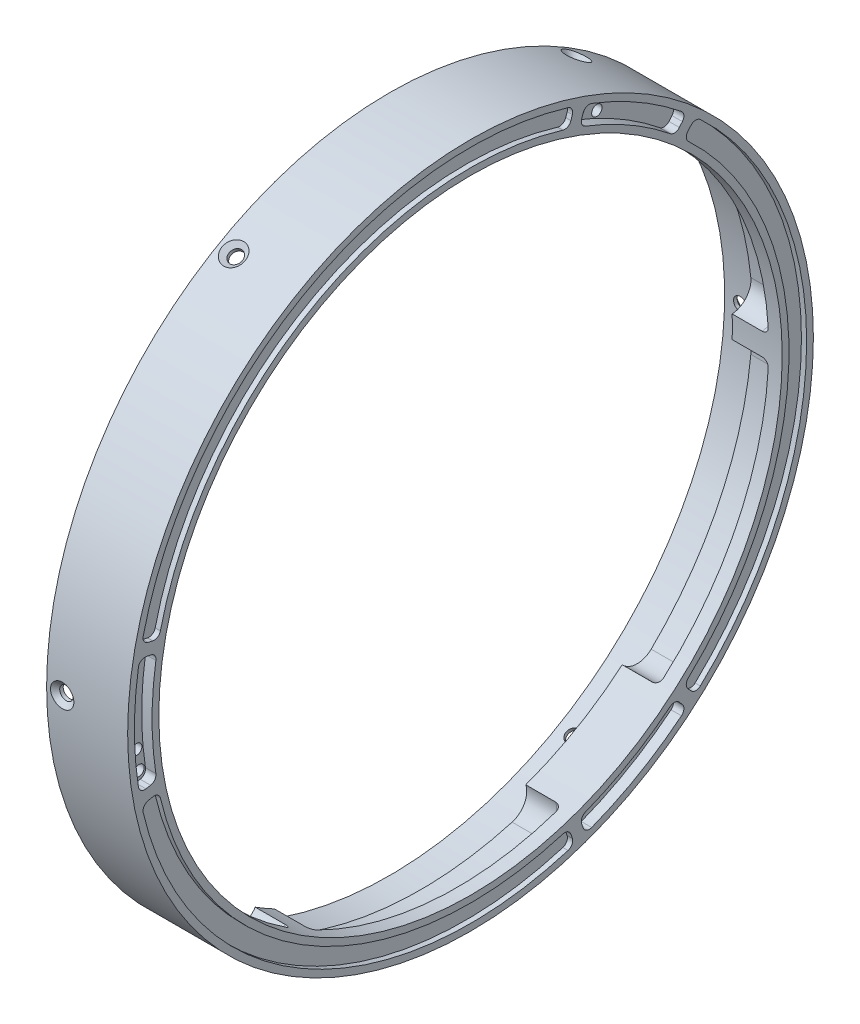
from build123d import *

# Parameters (mm, degrees)
CUT_EXTRUDE3_DEPTH       = 8.89
CIRPATTERN4_COUNT        = 6
FILLET1_R                = 1.5875
CIRPATTERN3_COUNT        = 3
FILLET1_OF_CIRPATTERN3_R = 1.5875
CUT_EXTRUDE4_DEPTH       = 2.54
FILLET2_R                = 1.5875
CIRPATTERN5_COUNT        = 3
FILLET2_OF_CIRPATTERN5_R = 1.5875
CUT_EXTRUDE5_DEPTH       = 1.27
SKETCH17_R               = 1.27
CUT_EXTRUDE6_DEPTH       = 182.467668846
FILLET3_R                = 1.5875
CIRPATTERN6_COUNT        = 3
FILLET3_OF_CIRPATTERN6_R = 1.5875


# Read off the part's stored shape, not the designer's step: CSK for #4 Flat Head Machine Screw (100)1
with BuildPart() as part:
    # Sketch1 → Revolve1 (revolve)
    with BuildSketch(Plane(origin=(0, 0, 0), x_dir=(1, 0, 0), z_dir=(0, 1, 0)), mode=Mode.PRIVATE) as revolve1_sk:
        Polygon((12.192, 0.508), (12.192, 0), (0, 0), (0, 5.7404), (-7.62, 5.7404), (-7.62, 7.62), (0.762, 7.62), (12.192, 7.62), align=None)
    revolve(revolve1_sk.sketch.rotate(Axis((-6.35, 0, 76.2), (1, 0, 0)), 180), axis=Axis((-6.35, 0, 76.2), (1, 0, 0)))

    # CSK for _4 Flat Head Machine Screw _ 2 → CSK for #4 Flat Head Machine Screw (100)1 (revolve, cut)
    with BuildSketch(Plane(origin=(-3.81, 0, 0), x_dir=(1, 0, 0), z_dir=(0, -1, 0))):
        Polygon((1.63195, -6.591641447), (1.63195, -5.724138447), (0, -5.724138447), (0, -7.620016713), (2.857519918, -7.620016713), align=None)
    csk_for_4_flat_head_machine_screw_100 = revolve(axis=Axis((-3.81, 0, 0), (0, 0, 1)), mode=Mode.SUBTRACT)

    # Sketch10 → Cut-Extrude3 (cut)
    with BuildSketch(Plane.ZY):
        with BuildLine():
            ThreePointArc((0.048494434, -2.718124364), (-3.381589747, -4.455320673), (-4.519407961, -8.128016987))
            ThreePointArc((-4.519407961, -8.128016987), (3.205581111, -35.404834314), (19.844033585, -58.358311586))
            ThreePointArc((19.844033585, -58.358311586), (23.432680554, -59.738507744), (26.92047459, -58.120292286))
            ThreePointArc((26.92047459, -58.120292286), (7.639180755, -33.254384139), (0.048494434, -2.718124364))
        make_face()
        with BuildLine():
            ThreePointArc((50.50611311, -71.737467034), (50.848594449, -75.567093032), (53.838202918, -77.984854382))
            ThreePointArc((53.838202918, -77.984854382), (82.035723427, -80.917438256), (109.520634569, -73.969066465))
            ThreePointArc((109.520634569, -73.969066465), (112.132373948, -71.147338844), (111.921788033, -67.308200539))
            ThreePointArc((111.921788033, -67.308200539), (81.681268171, -76.00260324), (50.50611311, -71.737467034))
        make_face()
    cut_extrude3 = extrude(amount=-CUT_EXTRUDE3_DEPTH, mode=Mode.SUBTRACT)

    # CirPattern4: CSK for #4 Flat Head Machine Screw (100)1 ×6 about axis
    cirpattern4_axis = Axis((-6.35, 0, 76.2), (-1, 0, 0))
    for i in range(1, CIRPATTERN4_COUNT):
        add(csk_for_4_flat_head_machine_screw_100.rotate(cirpattern4_axis, i * 360 / CIRPATTERN4_COUNT), mode=Mode.SUBTRACT)

    # Fillet1
    # the kernel refuses this fillet: 1.5875 mm, written as the material it adds along each edge
    with BuildSketch(Plane(origin=(8.89, 0, 76.2), x_dir=(0, -0.10018806161207054, -0.9949685182509123), z_dir=(0, 0.9949685182509123, -0.10018806161207054))) as fillet1_piece_1:
        with BuildLine():
            CenterArc((81.1276 - FILLET1_R, FILLET1_R), FILLET1_R, 270, 90)
            Line((81.1276, FILLET1_R), (81.1276, 0))
            Line((81.1276, 0), (81.1276 - FILLET1_R, 0))
        make_face()
    revolve(axis=Axis((8.89, 0, 76.2), (-1, 0, 0)), revolution_arc=40.25)
    with BuildSketch(Plane(origin=(8.89, -7.634330295, 0.383398909), x_dir=(0, 0.739996001928024, 0.6726112674721856), z_dir=(0, -0.6726112674721856, 0.739996001928024))) as fillet1_piece_2_section:
        with BuildLine():
            CenterArc((4.9276 - FILLET1_R, FILLET1_R), FILLET1_R, 270, 90)
            Line((4.9276, FILLET1_R), (4.9276, 0))
            Line((4.9276, 0), (4.9276 - FILLET1_R, 0))
        make_face()
    fillet1_piece_2 = revolve(axis=Axis((8.89, -7.634330295, 0.383398909), (-1, 0, 0)), revolution_arc=138.018925003, mode=Mode.PRIVATE)
    fillet1_piece_2 = fillet1_piece_2 - Plane(origin=(8.436876484, 0, 76.2), x_dir=(0, 0, 1), z_dir=(-1, 0, 0)) * Cylinder(76.2, 20, mode=Mode.PRIVATE)
    add(fillet1_piece_2)
    with BuildSketch(Plane(origin=(8.89, -54.813692786, 23.267032171), x_dir=(0, -0.7193398003386599, -0.6946583704589884), z_dir=(0, 0.6946583704589884, -0.7193398003386599))) as fillet1_piece_3_section:
        with BuildLine():
            CenterArc((4.9276 - FILLET1_R, FILLET1_R), FILLET1_R, 270, 90)
            Line((4.9276 - FILLET1_R, 0), (4.9276, 0))
            Line((4.9276, 0), (4.9276, FILLET1_R))
        make_face()
    fillet1_piece_3 = revolve(axis=Axis((8.89, -54.813692786, 23.267032171), (-1, 0, 0)), revolution_arc=138.018925003, mode=Mode.PRIVATE)
    fillet1_piece_3 = fillet1_piece_3 - Plane(origin=(8.436876481, 0, 76.2), x_dir=(0, 0, 1), z_dir=(-1, 0, 0)) * Cylinder(76.2, 20, mode=Mode.PRIVATE)
    add(fillet1_piece_3)
    with BuildSketch(Plane(origin=(8.89, -69.476267721, 107.496776569), x_dir=(0, -0.9117620635688755, 0.4107188082333531), z_dir=(0, -0.4107188082333531, -0.9117620635688755))) as fillet1_piece_4_section:
        with BuildLine():
            CenterArc((4.9276 - FILLET1_R, FILLET1_R), FILLET1_R, 270, 90)
            Line((4.9276 - FILLET1_R, 0), (4.9276, 0))
            Line((4.9276, 0), (4.9276, FILLET1_R))
        make_face()
    fillet1_piece_4 = revolve(axis=Axis((8.89, -69.476267721, 107.496776569), (-1, 0, 0)), revolution_arc=138.018927793, mode=Mode.PRIVATE)
    fillet1_piece_4 = fillet1_piece_4 - Plane(origin=(8.436876481, 0, 76.2), x_dir=(0, 0, 1), z_dir=(-1, 0, 0)) * Cylinder(76.2, 20, mode=Mode.PRIVATE)
    add(fillet1_piece_4)
    with BuildSketch(Plane(origin=(8.89, 0, 76.2), x_dir=(0, -0.9612616961718561, -0.27563735500255804), z_dir=(0, 0.27563735500255804, -0.9612616961718561))) as fillet1_piece_5:
        with BuildLine():
            CenterArc((81.1276 - FILLET1_R, FILLET1_R), FILLET1_R, 270, 90)
            Line((81.1276, FILLET1_R), (81.1276, 0))
            Line((81.1276, 0), (81.1276 - FILLET1_R, 0))
        make_face()
    revolve(axis=Axis((8.89, 0, 76.2), (-1, 0, 0)), revolution_arc=40.249999782)
    with BuildSketch(Plane(origin=(8.89, -73.24814123, 55.196433487), x_dir=(0, 0.8989387928419864, -0.43807424795780037), z_dir=(0, 0.43807424795780037, 0.8989387928419864))) as fillet1_piece_6_section:
        with BuildLine():
            CenterArc((4.9276 - FILLET1_R, FILLET1_R), FILLET1_R, 270, 90)
            Line((4.9276, FILLET1_R), (4.9276, 0))
            Line((4.9276, 0), (4.9276 - FILLET1_R, 0))
        make_face()
    fillet1_piece_6 = revolve(axis=Axis((8.89, -73.24814123, 55.196433487), (-1, 0, 0)), revolution_arc=138.018925802, mode=Mode.PRIVATE)
    fillet1_piece_6 = fillet1_piece_6 - Plane(origin=(8.436876484, 0, 76.2), x_dir=(0, 0, 1), z_dir=(-1, 0, 0)) * Cylinder(76.2, 20, mode=Mode.PRIVATE)
    add(fillet1_piece_6)

    # CirPattern3: Cut-Extrude3 ×3 about axis
    cirpattern3_axis = Axis((0, 0, 76.2), (1, 0, 0))
    for i in range(1, CIRPATTERN3_COUNT):
        add(cut_extrude3.rotate(cirpattern3_axis, i * 360 / CIRPATTERN3_COUNT), mode=Mode.SUBTRACT)

    # Fillet1 of CirPattern3
    # the kernel refuses this fillet: 1.5875 mm, written as the material it adds along each edge
    with BuildSketch(Plane(origin=(8.89, 0, 76.2), x_dir=(0, 0.9117620435770862, 0.4107188526134823), z_dir=(0, -0.4107188526134823, 0.9117620435770862))) as fillet1_of_cirpattern3_piece_1:
        with BuildLine():
            CenterArc((81.1276 - FILLET1_OF_CIRPATTERN3_R, FILLET1_OF_CIRPATTERN3_R), FILLET1_OF_CIRPATTERN3_R, 270, 90)
            Line((81.1276, FILLET1_OF_CIRPATTERN3_R), (81.1276, 0))
            Line((81.1276, 0), (81.1276 - FILLET1_OF_CIRPATTERN3_R, 0))
        make_face()
    revolve(axis=Axis((8.89, 0, 76.2), (-1, 0, 0)), revolution_arc=40.25)
    with BuildSketch(Plane(origin=(8.89, 69.476267721, 107.496776569), x_dir=(0, -0.9524964454665747, 0.30454970263249387), z_dir=(0, -0.30454970263249387, -0.9524964454665747))) as fillet1_of_cirpattern3_piece_2_section:
        with BuildLine():
            CenterArc((4.9276 - FILLET1_OF_CIRPATTERN3_R, FILLET1_OF_CIRPATTERN3_R), FILLET1_OF_CIRPATTERN3_R, 270, 90)
            Line((4.9276, FILLET1_OF_CIRPATTERN3_R), (4.9276, 0))
            Line((4.9276, 0), (4.9276 - FILLET1_OF_CIRPATTERN3_R, 0))
        make_face()
    fillet1_of_cirpattern3_piece_2 = revolve(axis=Axis((8.89, 69.476267721, 107.496776569), (-1, 0, 0)), revolution_arc=138.018925003, mode=Mode.PRIVATE)
    fillet1_of_cirpattern3_piece_2 = fillet1_of_cirpattern3_piece_2 - Plane(origin=(8.436876484, 0, 76.2), x_dir=(0, 0, 1), z_dir=(-1, 0, 0)) * Cylinder(76.2, 20, mode=Mode.PRIVATE)
    add(fillet1_of_cirpattern3_piece_2)
    with BuildSketch(Plane(origin=(8.89, 73.24814123, 55.196433487), x_dir=(0, 0.9612616959383153, -0.27563735581701143), z_dir=(0, 0.27563735581701143, 0.9612616959383153))) as fillet1_of_cirpattern3_piece_3_section:
        with BuildLine():
            CenterArc((4.9276 - FILLET1_OF_CIRPATTERN3_R, FILLET1_OF_CIRPATTERN3_R), FILLET1_OF_CIRPATTERN3_R, 270, 90)
            Line((4.9276 - FILLET1_OF_CIRPATTERN3_R, 0), (4.9276, 0))
            Line((4.9276, 0), (4.9276, FILLET1_OF_CIRPATTERN3_R))
        make_face()
    fillet1_of_cirpattern3_piece_3 = revolve(axis=Axis((8.89, 73.24814123, 55.196433487), (-1, 0, 0)), revolution_arc=138.018925003, mode=Mode.PRIVATE)
    fillet1_of_cirpattern3_piece_3 = fillet1_of_cirpattern3_piece_3 - Plane(origin=(8.436876481, 0, 76.2), x_dir=(0, 0, 1), z_dir=(-1, 0, 0)) * Cylinder(76.2, 20, mode=Mode.PRIVATE)
    add(fillet1_of_cirpattern3_piece_3)
    with BuildSketch(Plane(origin=(8.89, 7.634330295, 0.383398909), x_dir=(0, 0.10018811004228602, -0.9949685133742449), z_dir=(0, 0.9949685133742449, 0.10018811004228602))) as fillet1_of_cirpattern3_piece_4_section:
        with BuildLine():
            CenterArc((4.9276 - FILLET1_OF_CIRPATTERN3_R, FILLET1_OF_CIRPATTERN3_R), FILLET1_OF_CIRPATTERN3_R, 270, 90)
            Line((4.9276 - FILLET1_OF_CIRPATTERN3_R, 0), (4.9276, 0))
            Line((4.9276, 0), (4.9276, FILLET1_OF_CIRPATTERN3_R))
        make_face()
    fillet1_of_cirpattern3_piece_4 = revolve(axis=Axis((8.89, 7.634330295, 0.383398909), (-1, 0, 0)), revolution_arc=138.018927793, mode=Mode.PRIVATE)
    fillet1_of_cirpattern3_piece_4 = fillet1_of_cirpattern3_piece_4 - Plane(origin=(8.436876481, 0, 76.2), x_dir=(0, 0, 1), z_dir=(-1, 0, 0)) * Cylinder(76.2, 20, mode=Mode.PRIVATE)
    add(fillet1_of_cirpattern3_piece_4)
    with BuildSketch(Plane(origin=(8.89, 0, 76.2), x_dir=(0, 0.7193397997500929, -0.6946583710684673), z_dir=(0, 0.6946583710684673, 0.7193397997500929))) as fillet1_of_cirpattern3_piece_5:
        with BuildLine():
            CenterArc((81.1276 - FILLET1_OF_CIRPATTERN3_R, FILLET1_OF_CIRPATTERN3_R), FILLET1_OF_CIRPATTERN3_R, 270, 90)
            Line((81.1276, FILLET1_OF_CIRPATTERN3_R), (81.1276, 0))
            Line((81.1276, 0), (81.1276 - FILLET1_OF_CIRPATTERN3_R, 0))
        make_face()
    revolve(axis=Axis((8.89, 0, 76.2), (-1, 0, 0)), revolution_arc=40.249999782)
    with BuildSketch(Plane(origin=(8.89, 54.813692786, 23.267032171), x_dir=(0, -0.07008596894577407, 0.9975409550273774), z_dir=(0, -0.9975409550273774, -0.07008596894577407))) as fillet1_of_cirpattern3_piece_6_section:
        with BuildLine():
            CenterArc((4.9276 - FILLET1_OF_CIRPATTERN3_R, FILLET1_OF_CIRPATTERN3_R), FILLET1_OF_CIRPATTERN3_R, 270, 90)
            Line((4.9276, FILLET1_OF_CIRPATTERN3_R), (4.9276, 0))
            Line((4.9276, 0), (4.9276 - FILLET1_OF_CIRPATTERN3_R, 0))
        make_face()
    fillet1_of_cirpattern3_piece_6 = revolve(axis=Axis((8.89, 54.813692786, 23.267032171), (-1, 0, 0)), revolution_arc=138.018925802, mode=Mode.PRIVATE)
    fillet1_of_cirpattern3_piece_6 = fillet1_of_cirpattern3_piece_6 - Plane(origin=(8.436876484, 0, 76.2), x_dir=(0, 0, 1), z_dir=(-1, 0, 0)) * Cylinder(76.2, 20, mode=Mode.PRIVATE)
    add(fillet1_of_cirpattern3_piece_6)
    with BuildSketch(Plane(origin=(8.89, 0, 76.2), x_dir=(0, -0.8115739819650153, 0.5842496656374302), z_dir=(0, -0.5842496656374302, -0.8115739819650153))) as fillet1_of_cirpattern3_piece_7:
        with BuildLine():
            CenterArc((81.1276 - FILLET1_OF_CIRPATTERN3_R, FILLET1_OF_CIRPATTERN3_R), FILLET1_OF_CIRPATTERN3_R, 270, 90)
            Line((81.1276, FILLET1_OF_CIRPATTERN3_R), (81.1276, 0))
            Line((81.1276, 0), (81.1276 - FILLET1_OF_CIRPATTERN3_R, 0))
        make_face()
    revolve(axis=Axis((8.89, 0, 76.2), (-1, 0, 0)), revolution_arc=40.25)
    with BuildSketch(Plane(origin=(8.89, -61.841937426, 120.719824522), x_dir=(0, 0.2125004435385481, -0.9771609701046806), z_dir=(0, 0.9771609701046806, 0.2125004435385481))) as fillet1_of_cirpattern3_piece_8_section:
        with BuildLine():
            CenterArc((4.9276 - FILLET1_OF_CIRPATTERN3_R, FILLET1_OF_CIRPATTERN3_R), FILLET1_OF_CIRPATTERN3_R, 270, 90)
            Line((4.9276, FILLET1_OF_CIRPATTERN3_R), (4.9276, 0))
            Line((4.9276, 0), (4.9276 - FILLET1_OF_CIRPATTERN3_R, 0))
        make_face()
    fillet1_of_cirpattern3_piece_8 = revolve(axis=Axis((8.89, -61.841937426, 120.719824522), (-1, 0, 0)), revolution_arc=138.018925003, mode=Mode.PRIVATE)
    fillet1_of_cirpattern3_piece_8 = fillet1_of_cirpattern3_piece_8 - Plane(origin=(8.436876484, 0, 76.2), x_dir=(0, 0, 1), z_dir=(-1, 0, 0)) * Cylinder(76.2, 20, mode=Mode.PRIVATE)
    add(fillet1_of_cirpattern3_piece_8)
    with BuildSketch(Plane(origin=(8.89, -18.434448445, 150.136534342), x_dir=(0, -0.24192189559965435, 0.9702957262759998), z_dir=(0, -0.9702957262759998, -0.24192189559965435))) as fillet1_of_cirpattern3_piece_9_section:
        with BuildLine():
            CenterArc((4.9276 - FILLET1_OF_CIRPATTERN3_R, FILLET1_OF_CIRPATTERN3_R), FILLET1_OF_CIRPATTERN3_R, 270, 90)
            Line((4.9276 - FILLET1_OF_CIRPATTERN3_R, 0), (4.9276, 0))
            Line((4.9276, 0), (4.9276, FILLET1_OF_CIRPATTERN3_R))
        make_face()
    fillet1_of_cirpattern3_piece_9 = revolve(axis=Axis((8.89, -18.434448445, 150.136534342), (-1, 0, 0)), revolution_arc=138.018925003, mode=Mode.PRIVATE)
    fillet1_of_cirpattern3_piece_9 = fillet1_of_cirpattern3_piece_9 - Plane(origin=(8.436876481, 0, 76.2), x_dir=(0, 0, 1), z_dir=(-1, 0, 0)) * Cylinder(76.2, 20, mode=Mode.PRIVATE)
    add(fillet1_of_cirpattern3_piece_9)
    with BuildSketch(Plane(origin=(8.89, 61.841937426, 120.719824522), x_dir=(0, 0.8115739535265906, 0.584249705140892), z_dir=(0, -0.584249705140892, 0.8115739535265906))) as fillet1_of_cirpattern3_piece_10_section:
        with BuildLine():
            CenterArc((4.9276 - FILLET1_OF_CIRPATTERN3_R, FILLET1_OF_CIRPATTERN3_R), FILLET1_OF_CIRPATTERN3_R, 270, 90)
            Line((4.9276 - FILLET1_OF_CIRPATTERN3_R, 0), (4.9276, 0))
            Line((4.9276, 0), (4.9276, FILLET1_OF_CIRPATTERN3_R))
        make_face()
    fillet1_of_cirpattern3_piece_10 = revolve(axis=Axis((8.89, 61.841937426, 120.719824522), (-1, 0, 0)), revolution_arc=138.018927793, mode=Mode.PRIVATE)
    fillet1_of_cirpattern3_piece_10 = fillet1_of_cirpattern3_piece_10 - Plane(origin=(8.436876481, 0, 76.2), x_dir=(0, 0, 1), z_dir=(-1, 0, 0)) * Cylinder(76.2, 20, mode=Mode.PRIVATE)
    add(fillet1_of_cirpattern3_piece_10)
    with BuildSketch(Plane(origin=(8.89, 0, 76.2), x_dir=(0, 0.2419218964217636, 0.970295726071025), z_dir=(0, -0.970295726071025, 0.2419218964217636))) as fillet1_of_cirpattern3_piece_11:
        with BuildLine():
            CenterArc((81.1276 - FILLET1_OF_CIRPATTERN3_R, FILLET1_OF_CIRPATTERN3_R), FILLET1_OF_CIRPATTERN3_R, 270, 90)
            Line((81.1276, FILLET1_OF_CIRPATTERN3_R), (81.1276, 0))
            Line((81.1276, 0), (81.1276 - FILLET1_OF_CIRPATTERN3_R, 0))
        make_face()
    revolve(axis=Axis((8.89, 0, 76.2), (-1, 0, 0)), revolution_arc=40.249999782)
    with BuildSketch(Plane(origin=(8.89, 18.434448445, 150.136534342), x_dir=(0, -0.8288528238962096, -0.5594667070695798), z_dir=(0, 0.5594667070695798, -0.8288528238962096))) as fillet1_of_cirpattern3_piece_12_section:
        with BuildLine():
            CenterArc((4.9276 - FILLET1_OF_CIRPATTERN3_R, FILLET1_OF_CIRPATTERN3_R), FILLET1_OF_CIRPATTERN3_R, 270, 90)
            Line((4.9276, FILLET1_OF_CIRPATTERN3_R), (4.9276, 0))
            Line((4.9276, 0), (4.9276 - FILLET1_OF_CIRPATTERN3_R, 0))
        make_face()
    fillet1_of_cirpattern3_piece_12 = revolve(axis=Axis((8.89, 18.434448445, 150.136534342), (-1, 0, 0)), revolution_arc=138.018925802, mode=Mode.PRIVATE)
    fillet1_of_cirpattern3_piece_12 = fillet1_of_cirpattern3_piece_12 - Plane(origin=(8.436876484, 0, 76.2), x_dir=(0, 0, 1), z_dir=(-1, 0, 0)) * Cylinder(76.2, 20, mode=Mode.PRIVATE)
    add(fillet1_of_cirpattern3_piece_12)

    # Sketch15 → Cut-Extrude4 (cut)
    with BuildSketch(Plane(origin=(12.192, 0, 0), x_dir=(0, 0, -1), z_dir=(1, 0, 0))):
        with BuildLine():
            ThreePointArc((-152.86826838, -13.51868428), (-154.051, 0), (-152.86826838, 13.51868428))
            Line((-152.86826838, 13.51868428), (-157.120668257, 14.268497111))
            ThreePointArc((-157.120668257, 14.268497111), (-158.369, 0), (-157.120668257, -14.268497111))
            Line((-157.120668257, -14.268497111), (-152.86826838, -13.51868428))
        make_face()
    cut_extrude4 = extrude(amount=-CUT_EXTRUDE4_DEPTH, mode=Mode.SUBTRACT)

    # Fillet2
    fillet2_edges = [part.edges().sort_by_distance(p)[0] for p in [
        (10.922, 13.51868428, 152.86826838),
        (10.922, -13.51868428, 152.86826838),
        (10.922, -14.268497111, 157.120668257),
        (10.922, 14.268497111, 157.120668257),
    ]]
    fillet(fillet2_edges, radius=FILLET2_R)

    # CirPattern5: Cut-Extrude4 ×3 about axis
    cirpattern5_axis = Axis((0, 0, 76.2), (1, 0, 0))
    for i in range(1, CIRPATTERN5_COUNT):
        add(cut_extrude4.rotate(cirpattern5_axis, i * 360 / CIRPATTERN5_COUNT), mode=Mode.SUBTRACT)

    # Fillet2 of CirPattern5
    fillet2_of_cirpattern5_edges = [part.edges().sort_by_distance(p)[0] for p in [
        (10.922, -73.156010221, 49.573389822),
        (10.922, -59.637325941, 26.158341798),
        (10.922, -62.945105847, 23.3827849),
        (10.922, -77.213602957, 48.096546843),
        (10.922, 59.637325941, 26.158341798),
        (10.922, 73.156010221, 49.573389822),
        (10.922, 77.213602957, 48.096546843),
        (10.922, 62.945105847, 23.3827849),
    ]]
    fillet(fillet2_of_cirpattern5_edges, radius=FILLET2_OF_CIRPATTERN5_R)

    # Sketch16 → Cut-Extrude5 (cut)
    with BuildSketch(Plane(origin=(12.192, 0, 0), x_dir=(0, 0, -1), z_dir=(1, 0, 0))):
        with BuildLine():
            ThreePointArc((-52.142717971, -74.04070085), (-115.1255, -67.42094371), (-152.349768865, -16.186133042))
            Line((-152.349768865, -16.186133042), (-156.573410205, -17.083895723))
            ThreePointArc((-156.573410205, -17.083895723), (-117.2845, -71.160441404), (-50.808382589, -78.147362887))
            Line((-50.808382589, -78.147362887), (-52.142717971, -74.04070085))
        make_face()
    cut_extrude5 = extrude(amount=-CUT_EXTRUDE5_DEPTH, mode=Mode.SUBTRACT)

    # Sketch17 → Cut-Extrude6 (cut, through all)
    with BuildSketch(Plane(origin=(9.652, 0, 0), x_dir=(0, 0, -1), z_dir=(1, 0, 0))):
        with Locations((-26.752057178, -62.09099432)):
            Circle(SKETCH17_R)
        with Locations((-30.5648463, -64.944771705)):
            Circle(SKETCH17_R)
    cut_extrude6 = extrude(amount=-CUT_EXTRUDE6_DEPTH, mode=Mode.SUBTRACT)

    # Fillet3
    fillet3_edges = [part.edges().sort_by_distance(p)[0] for p in [
        (11.557, -17.083895723, 156.573410205),
        (11.557, -16.186133042, 152.349768865),
        (11.557, -74.04070085, 52.142717971),
        (11.557, -78.147362887, 50.808382589),
    ]]
    fillet(fillet3_edges, radius=FILLET3_R)

    # CirPattern6: Cut-Extrude5, Cut-Extrude6 ×3 about axis
    cirpattern6_axis = Axis((0, 0, 76.2), (1, 0, 0))
    add([cut_extrude5.rotate(cirpattern6_axis, i * 360 / CIRPATTERN6_COUNT) for i in range(1, CIRPATTERN6_COUNT)], mode=Mode.SUBTRACT)
    add([cut_extrude6.rotate(cirpattern6_axis, i * 360 / CIRPATTERN6_COUNT) for i in range(1, CIRPATTERN6_COUNT)], mode=Mode.SUBTRACT)

    # Fillet3 of CirPattern6
    fillet3_of_cirpattern6_edges = [part.edges().sort_by_distance(p)[0] for p in [
        (11.557, -61.063467165, 21.218207206),
        (11.557, -57.854567808, 24.107513164),
        (11.557, 57.854567808, 24.107513164),
        (11.557, 61.063467165, 21.218207206),
        (11.557, 78.147362887, 50.808382589),
        (11.557, 74.04070085, 52.142717971),
        (11.557, 16.186133042, 152.349768865),
        (11.557, 17.083895723, 156.573410205),
    ]]
    fillet(fillet3_of_cirpattern6_edges, radius=FILLET3_OF_CIRPATTERN6_R)


solid = part.part
